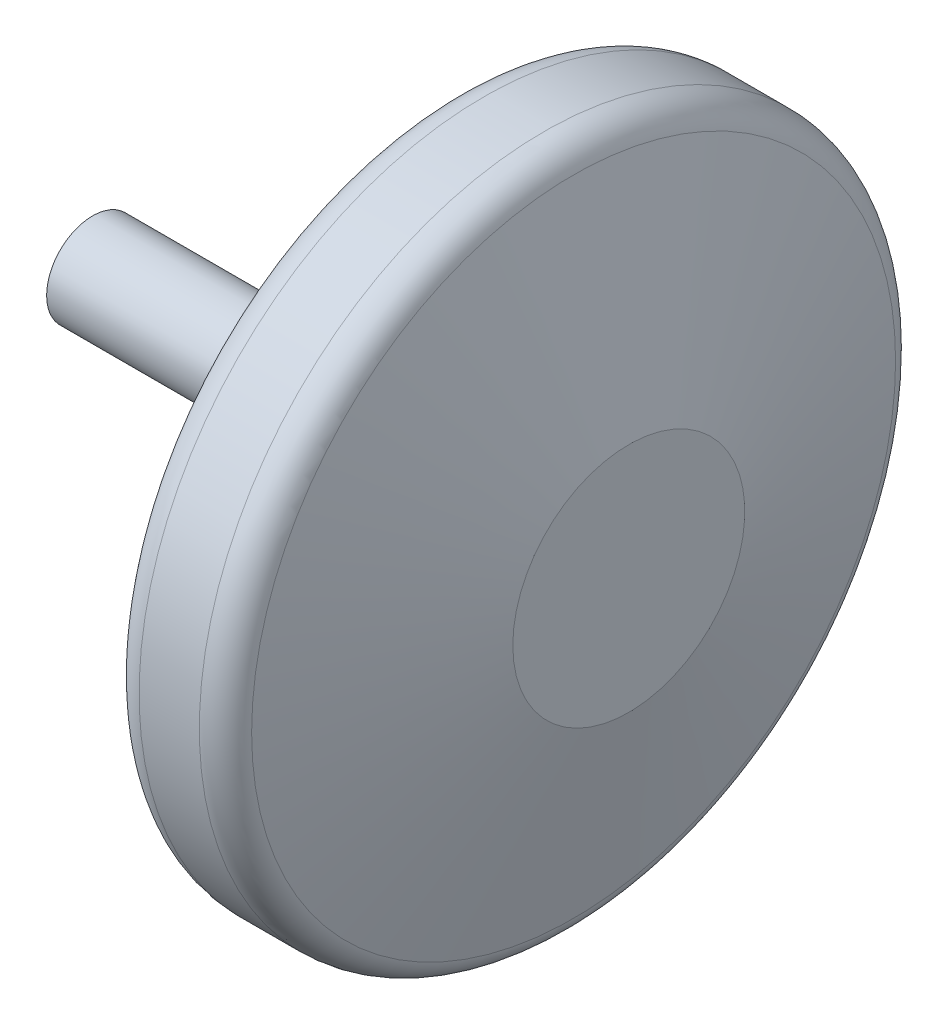
from build123d import *

# Parameters (mm, degrees)
FILLET_1_R = 2


with BuildPart() as part:
    # Эскиз1 → Повернуть1 (revolve)
    with BuildSketch(Plane.XY):
        Polygon((0, 0), (0, 3), (20, 3), (20, 7.57179677), (24, 22.5), (31, 22.5), (35, 7.57179677), (35, 0), (26, 0), align=None)
    revolve(axis=Axis((0, 0, 0), (1, 0, 0)))

    # Скругление1
    fillet_1_edges = [part.edges().sort_by_distance(p)[0] for p in [
        (24, -22.5, 0),
        (31, -22.5, 0),
    ]]
    fillet(fillet_1_edges, radius=FILLET_1_R)


solid = part.part
